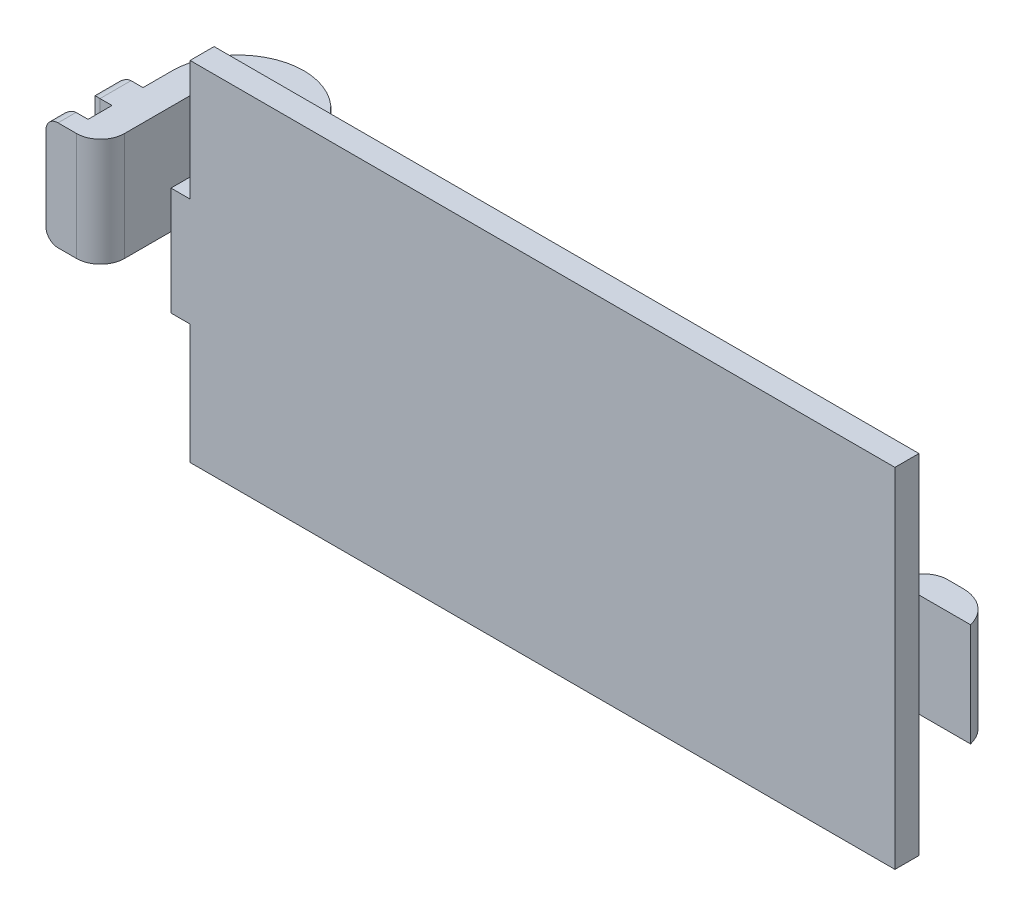
from build123d import *

# Parameters (mm, degrees)
SKETCH1_W           = 58.7
SKETCH1_H           = 14.5
BOSS_EXTRUDE1_DEPTH = 2
SKETCH2_W           = 1.907537222
SKETCH2_H           = 8.6
BOSS_EXTRUDE2_DEPTH = 4.3
SKETCH3_W           = 2.3
SKETCH3_H           = 8.6
BOSS_EXTRUDE3_DEPTH = 4.3
FILLET3_R           = 2
SKETCH4_W           = 0.949738238
SKETCH4_H           = 9
BOSS_EXTRUDE4_DEPTH = 12
SKETCH5_W           = 14
SKETCH5_H           = 9.016953004
BOSS_EXTRUDE5_DEPTH = 10
FILLET4_R           = 5.5
CUT_EXTRUDE1_DEPTH  = 12
SKETCH8_W           = 2.580145407
SKETCH8_H           = 9.016953004
SKETCH8_W_2         = 1.5
BOSS_EXTRUDE6_DEPTH = 2
SKETCH9_W           = 1.920869139
SKETCH9_H           = 1.685794619
SKETCH9_H_2         = 1.68579462
BOSS_EXTRUDE7_DEPTH = 3
FILLET6_R           = 3
FILLET9_R           = 3
FILLET11_R          = 1
FILLET12_R          = 1
FILLET13_R          = 2


with BuildPart() as part:
    # Sketch1 → Boss-Extrude1 (new body)
    with BuildSketch(Plane.XY):
        with Locations((15.900667763, -7.24741023)):
            Rectangle(SKETCH1_W, SKETCH1_H)
        with Locations((15.900667763, 7.25258977)):
            Rectangle(SKETCH1_W, SKETCH1_H)
    extrude(amount=BOSS_EXTRUDE1_DEPTH)

    # Sketch2 → Boss-Extrude2 (add)
    with BuildSketch(Plane.XY.offset(2)):
        with Locations((44.296899152, 0)):
            Rectangle(SKETCH2_W, SKETCH2_H)
    extrude(amount=-BOSS_EXTRUDE2_DEPTH)

    # Sketch3 → Boss-Extrude3 (add)
    with BuildSketch(Plane(origin=(45.250667763, 0, 0), x_dir=(0, 0, -1), z_dir=(1, 0, 0))):
        with Locations((1.15, 0)):
            Rectangle(SKETCH3_W, SKETCH3_H)
    extrude(amount=BOSS_EXTRUDE3_DEPTH)

    # Fillet3
    fillet3_edges = [part.edges().sort_by_distance(p)[0] for p in [
        (43.343130541, 0, -2.3),
    ]]
    fillet(fillet3_edges, radius=FILLET3_R)

    # Sketch4 → Boss-Extrude4 (add)
    with BuildSketch(Plane(origin=(0, 0, 0), x_dir=(-1, 0, 0), z_dir=(0, 0, -1))):
        with Locations((12.974463118, 0.00258977)):
            Rectangle(SKETCH4_W, SKETCH4_H)
    extrude(amount=BOSS_EXTRUDE4_DEPTH)

    # Sketch5 → Boss-Extrude5 (add)
    with BuildSketch(Plane.ZY.offset(13.449332237)):
        with Locations((-5, -0.005886732)):
            Rectangle(SKETCH5_W, SKETCH5_H)
    extrude(amount=BOSS_EXTRUDE5_DEPTH)

    # Fillet4
    # the kernel refuses this fillet: 5.5 mm, written as the material it takes off along each edge
    with BuildSketch(Plane(origin=(-23.449332237, -18.264363234, -12), x_dir=(1, 0, 0), z_dir=(0, 1, 0))) as fillet4_piece_1:
        with BuildLine():
            CenterArc((FILLET4_R, -FILLET4_R), FILLET4_R, 90, 90)
            Line((0, -FILLET4_R), (0, 0))
            Line((0, 0), (FILLET4_R, 0))
        make_face()
    extrude(amount=36.516953004, mode=Mode.SUBTRACT)
    with BuildSketch(Plane(origin=(-12.499593999, -18.24741023, -12), x_dir=(-1, 0, 0), z_dir=(0, 1, 0))) as fillet4_piece_2:
        with BuildLine():
            CenterArc((FILLET4_R, FILLET4_R), FILLET4_R, 180, 90)
            Line((0, FILLET4_R), (0, 0))
            Line((0, 0), (FILLET4_R, 0))
        make_face()
    extrude(amount=36.5, mode=Mode.SUBTRACT)

    # Sketch7 → Cut-Extrude1 (cut)
    with BuildSketch(Plane(origin=(0, 4.50258977, 0), x_dir=(1, 0, 0), z_dir=(0, 1, 0))):
        with BuildLine():
            ThreePointArc((-15.03934254, 6.5), (-17.974463118, 9.435120578), (-20.909583696, 6.5))
            Line((-20.909583696, 6.5), (-15.03934254, 6.5))
        make_face()
        with BuildLine():
            Line((-15.03934254, 6.5), (-20.909583696, 6.5))
            ThreePointArc((-20.909583696, 6.5), (-17.974463118, 3.564879422), (-15.03934254, 6.5))
        make_face()
        with BuildLine():
            ThreePointArc((-15.03934254, 6.5), (-17.974463118, 3.564879422), (-20.909583696, 6.5))
            Line((-20.909583696, 6.5), (-20.909583696, -2))
            Line((-20.909583696, -2), (-15.03934254, -2))
            Line((-15.03934254, -2), (-15.03934254, 6.5))
        make_face()
    extrude(amount=-CUT_EXTRUDE1_DEPTH, mode=Mode.SUBTRACT)

    # Sketch8 → Boss-Extrude6 (add)
    with BuildSketch(Plane.ZY.offset(23.449332237)):
        with Locations((-2.790072703, -0.005886732)):
            Rectangle(SKETCH8_W, SKETCH8_H)
        with Locations((1.25, -0.005886732)):
            Rectangle(SKETCH8_W_2, SKETCH8_H)
    extrude(amount=BOSS_EXTRUDE6_DEPTH)

    # Sketch9 → Boss-Extrude7 (add)
    with BuildSketch(Plane(origin=(0, 0, 0), x_dir=(-1, 0, 0), z_dir=(0, 0, -1))):
        with Locations((11.550124457, -3.589191377)):
            Rectangle(SKETCH9_W, SKETCH9_H)
        with Locations((11.539159429, 3.65969246)):
            Rectangle(SKETCH9_W, SKETCH9_H_2)
    extrude(amount=BOSS_EXTRUDE7_DEPTH)

    # Fillet6
    # the kernel refuses this fillet: 3 mm, written as the material it takes off along each edge
    with BuildSketch(Plane(origin=(-10.589689887, 4.241056538, -3), x_dir=(-1, 0, 0), z_dir=(0, -1, 0))) as fillet6_piece_1_section:
        with BuildLine():
            CenterArc((3, -2.794940242), FILLET6_R, 111.307014795, 68.692985205)
            Line((0, -2.794940242), (0, 0))
            Line((0, 0), (1.909904112, 0))
        make_face()
    fillet6_piece_1 = extrude(amount=15.660495829, mode=Mode.PRIVATE)
    fillet6_piece_1 = split(fillet6_piece_1, bisect_by=Plane(origin=(-11.107813793, 2.81679515, -1.901033535), z_dir=(0, -1, 0)), keep=Keep.TOP, mode=Mode.PRIVATE)
    add(fillet6_piece_1, mode=Mode.SUBTRACT)
    with BuildSketch(Plane(origin=(-10.57872486, 11.500570097, -3), x_dir=(-1, 0, 0), z_dir=(0, -1, 0))) as fillet6_piece_2:
        with BuildLine():
            CenterArc((3, -2.799192131), FILLET6_R, 111.082404826, 68.917595174)
            Line((0, -2.799192131), (0, 0))
            Line((0, 0), (1.920869139, 0))
        make_face()
    extrude(amount=15.681755273, mode=Mode.SUBTRACT)

    # Fillet9
    # the kernel refuses this fillet: 3 mm, written as the material it takes off along each edge
    with BuildSketch(Plane(origin=(49.550667763, 11.592976073, -2.3), x_dir=(-1, 0, 0), z_dir=(0, -1, 0))) as fillet9_piece_1:
        with BuildLine():
            CenterArc((2.917190429, -3), FILLET9_R, 90, 76.506601178)
            Line((0, -2.3), (-0.058343809, -2.286))
            ThreePointArc((-0.058343809, -2.286), (-0.06, -1.15), (-0.06, 0))
            Line((-0.06, 0), (0, 0.06))
            Line((0, 0.06), (2.917190429, 0.06))
            Line((2.917190429, 0.06), (2.917190429, 0))
        make_face()
    extrude(amount=23.185952146, mode=Mode.SUBTRACT)

    # Fillet11
    fillet11_edges = [part.edges().sort_by_distance(p)[0] for p in [
        (-25.449332237, -0.005886732, -4.080145407),
        (-25.449332237, -4.514363234, -2.790072704),
        (-25.449332237, -0.005886732, -1.5),
        (-25.449332237, 4.50258977, -2.790072704),
    ]]
    fillet(fillet11_edges, radius=FILLET11_R)

    # Fillet12
    fillet12_edges = [part.edges().sort_by_distance(p)[0] for p in [
        (-25.449332237, 4.50258977, 1.25),
        (-25.449332237, -0.005886732, 0.5),
        (-25.449332237, -4.514363234, 1.25),
    ]]
    fillet(fillet12_edges, radius=FILLET12_R)

    # Fillet13
    fillet13_edges = [part.edges().sort_by_distance(p)[0] for p in [
        (-20.909583696, -0.005886732, 2),
    ]]
    fillet(fillet13_edges, radius=FILLET13_R)


solid = part.part
